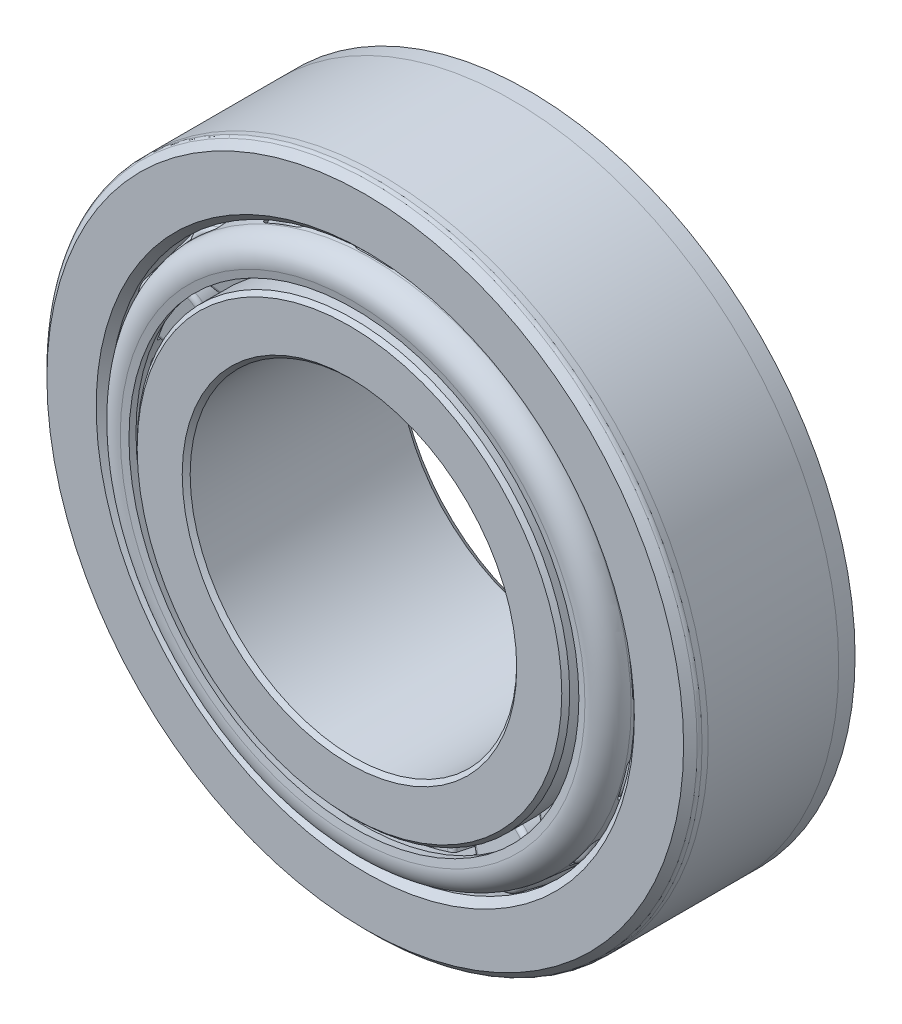
from build123d import *
from OCP.BRepFilletAPI import BRepFilletAPI_MakeChamfer

# Parameters (mm, degrees)
SKETCH8_R                 = 2.0375
CUT_EXTRUDE1_DEPTH        = 0.635
FILLET7_R                 = 0.9525
CHAMFER4_SIZE             = 0.509375
CHAMFER4_SIZE2            = 0.497844484
FILLET8_R                 = 0.54975
CIRPATTERN1_COUNT         = 17
FILLET9_R                 = 2.6025
FILLET10_R                = 0.32825
FILLET11_R                = 0.3665
CIRPATTERN2_COUNT         = 17
FILLET11_OF_CIRPATTERN2_R = 0.3665
CHAMFER1_SIZE             = 0.9575
CHAMFER1_SIZE2            = 0.812762916
FILLET6_R                 = 0.5745
CHAMFER2_SIZE             = 0.463875
CHAMFER3_SIZE             = 0.9055


with BuildPart() as part:
    # Sketch2 → Revolve1 (revolve)
    with BuildSketch(Plane(origin=(0, 0, 0), x_dir=(0, 0, -1), z_dir=(1, 0, 0)), mode=Mode.PRIVATE) as revolve1_sk:
        Polygon((-9.525, 38.1), (-9.525, 30.44), (9.525, 34.285), (9.525, 38.1), align=None)
    revolve(revolve1_sk.sketch.rotate(Axis((0, 0, 0), (0, 0, -1)), 90), axis=Axis((0, 0, 0), (0, 0, -1)))

    # Chamfer1: one chamfer whose edges measure the first distance from different faces: ONE call of the kernel's chamfer builder (chamfer() names one face for all edges)
    chamfer1_edges_1 = [part.edges().sort_by_distance(p)[0] for p in [
        (-30.44, 0, 9.525),
    ]]
    chamfer1_side_1 = [part.faces().sort_by_distance(p)[0] for p in [
        (-37.022369265, 0, 9.525),
    ]]
    chamfer1_edges_2 = [part.edges().sort_by_distance(p)[0] for p in [
        (-38.1, 0, 9.525),
    ]]
    chamfer1 = BRepFilletAPI_MakeChamfer(part.part.solid().wrapped)
    for e in chamfer1_edges_1:
        chamfer1.Add(CHAMFER1_SIZE, CHAMFER1_SIZE2, e.wrapped, chamfer1_side_1[0].wrapped)  # the first distance lies on this face
    for e in chamfer1_edges_2:
        chamfer1.Add(CHAMFER1_SIZE, e.wrapped)
    add(Compound.cast(chamfer1.Shape()), mode=Mode.REPLACE)

    # Fillet6
    fillet6_edges = [part.edges().sort_by_distance(p)[0] for p in [
        (-38.1, 0, 8.5675),
    ]]
    fillet(fillet6_edges, radius=FILLET6_R)


with BuildPart() as body_2:
    # Sketch3 → Revolve2 (revolve)
    with BuildSketch(Plane(origin=(0, 0, 0), x_dir=(0, 0, -1), z_dir=(1, 0, 0)), mode=Mode.PRIVATE) as revolve2_sk:
        Polygon((-11.3665, 25.235), (-11.3665, 19.05), (14.2875, 19.05), (14.2875, 28.105), (9.637718444, 28.105), (9.999281251, 26.068659801), (-7.293053691, 23.41472833), (-7.616252405, 25.235), align=None)
    revolve(revolve2_sk.sketch.rotate(Axis((0, 0, 0), (0, 0, -1)), 90), axis=Axis((0, 0, 0), (0, 0, -1)))

    # Chamfer2
    chamfer2_edges = [body_2.edges().sort_by_distance(p)[0] for p in [
        (-19.05, 0, 11.3665),
        (-25.235, 0, 11.3665),
    ]]
    chamfer(chamfer2_edges, length=CHAMFER2_SIZE)

    # Chamfer3
    chamfer3_edges = [body_2.edges().sort_by_distance(p)[0] for p in [
        (-28.105, 0, -14.2875),
        (-19.05, 0, -14.2875),
    ]]
    chamfer(chamfer3_edges, length=CHAMFER3_SIZE)


with BuildPart() as body_3:
    # Sketch4 → Revolve3 (revolve)
    with BuildSketch(Plane(origin=(0, 0, 0), x_dir=(0, 0, -1), z_dir=(1, 0, 0)), mode=Mode.PRIVATE) as revolve3_sk:
        Polygon((13.2715, 31.042304933), (13.094930889, 32.036751186), (-11.497784022, 29.908535063), (-10.847646334, 26.246926388), (-9.853200081, 26.423495499), (-9.941484637, 26.920718625), align=None)
    revolve(revolve3_sk.sketch.rotate(Axis((0, 0, 0), (0, 0, -1)), 90), axis=Axis((0, 0, 0), (0, 0, -1)))

    # Fillet9
    fillet9_edges = [body_3.edges().sort_by_distance(p)[0] for p in [
        (-29.908535063, 0, 11.497784022),
    ]]
    fillet(fillet9_edges, radius=FILLET9_R)

    # Fillet10
    fillet10_edges = [body_3.edges().sort_by_distance(p)[0] for p in [
        (-32.036751186, 0, -13.094930889),
        (-31.042304933, 0, -13.2715),
    ]]
    fillet(fillet10_edges, radius=FILLET10_R)

    # Sketch9 → Cut-Revolve2 (revolve, cut)
    with BuildSketch(Plane(origin=(0, 0, 0), x_dir=(0, 0, -1), z_dir=(1, 0, 0))):
        Polygon((-7.933772296, 27.023288246), (9.286886076, 30.080905819), (10.047348348, 25.797943455), (-7.244986594, 23.144011984), align=None)
    cut_revolve2 = revolve(axis=Axis((0, 27.023288246, 7.933772296), (0, 0.1748209018666769, -0.9846002499849986)), mode=Mode.SUBTRACT)

    # Fillet11
    fillet11_edges = [body_3.edges().sort_by_distance(p)[0] for p in [
        (-3.551195057, 28.703532077, 8.232108338),
        (3.551195057, 28.703532077, 8.232108338),
        (4.299952946, 30.728406183, -9.171919015),
        (-4.299952946, 30.728406183, -9.171919015),
    ]]
    fillet(fillet11_edges, radius=FILLET11_R)

    # CirPattern2: Cut-Revolve2 ×17 about axis
    cirpattern2_axis = Axis((0, 0, 0), (0, 0, 1))
    for i in range(1, CIRPATTERN2_COUNT):
        add(cut_revolve2.rotate(cirpattern2_axis, i * 360 / CIRPATTERN2_COUNT), mode=Mode.SUBTRACT)

    # Fillet11 of CirPattern2
    fillet11_of_cirpattern2_edges = [body_3.edges().sort_by_distance(p)[0] for p in [
        (-13.680302525, 25.482406928, 8.232108338),
        (-7.057520981, 28.048086167, 8.232108338),
        (-7.090793939, 30.206707586, -9.171919015),
        (-15.109967359, 27.100063253, -9.171919015),
        (-21.961809332, 18.819741521, 8.232108338),
        (-16.713079703, 23.6045908, 8.232108338),
        (-17.523889811, 25.605425749, -9.171919015),
        (-23.879296952, 19.811706613, -9.171919015),
        (-27.277252093, 9.615365737, 8.232108338),
        (-24.111444401, 15.973164649, 8.232108338),
        (-25.590287261, 17.545989279, -9.171919015),
        (-29.423595173, 9.847669216, -9.171919015),
        (-28.908750811, -0.88761847, 8.232108338),
        (-28.253424927, 6.184474101, 8.232108338),
        (-30.200574615, 7.116869732, -9.171919015),
        (-30.994073823, -1.446350477, -9.171919015),
        (-26.635962543, -11.270724884, 8.232108338),
        (-28.579623859, -4.439463944, 8.232108338),
        (-30.732107021, -4.273422508, -9.171919015),
        (-28.37863106, -12.545032524, -9.171919015),
        (-20.765839939, -20.131657449, 8.232108338),
        (-25.045986223, -14.463827783, 8.232108338),
        (-27.113098081, -15.086565359, -9.171919015),
        (-21.930496921, -21.949438414, -9.171919015),
        (-12.091175583, -26.273698122, 8.232108338),
        (-18.129749363, -22.534771533, 8.232108338),
        (-19.832315006, -23.862183961, -9.171919015),
        (-12.520527651, -28.38945102, -9.171919015),
        (-1.783530966, -28.867330277, 8.232108338),
        (-8.764989392, -27.562269518, 8.232108338),
        (-9.873067895, -29.415082393, -9.171919015),
        (-1.419591744, -30.995310954, -9.171919015),
        (8.764989392, -27.562269518, 8.232108338),
        (1.783530966, -28.867330277, 8.232108338),
        (1.419591744, -30.995310954, -9.171919015),
        (9.873067895, -29.415082393, -9.171919015),
        (18.129749363, -22.534771533, 8.232108338),
        (12.091175583, -26.273698122, 8.232108338),
        (12.520527651, -28.38945102, -9.171919015),
        (19.832315006, -23.862183961, -9.171919015),
        (25.045986223, -14.463827783, 8.232108338),
        (20.765839939, -20.131657449, 8.232108338),
        (21.930496921, -21.949438414, -9.171919015),
        (27.113098081, -15.086565359, -9.171919015),
        (28.579623859, -4.439463944, 8.232108338),
        (26.635962543, -11.270724884, 8.232108338),
        (28.37863106, -12.545032524, -9.171919015),
        (30.732107021, -4.273422508, -9.171919015),
        (28.253424927, 6.184474101, 8.232108338),
        (28.908750811, -0.88761847, 8.232108338),
        (30.994073823, -1.446350477, -9.171919015),
        (30.200574615, 7.116869732, -9.171919015),
        (24.111444401, 15.973164649, 8.232108338),
        (27.277252093, 9.615365737, 8.232108338),
        (29.423595173, 9.847669216, -9.171919015),
        (25.590287261, 17.545989279, -9.171919015),
        (16.713079703, 23.6045908, 8.232108338),
        (21.961809332, 18.819741521, 8.232108338),
        (23.879296952, 19.811706613, -9.171919015),
        (17.523889811, 25.605425749, -9.171919015),
        (7.057520981, 28.048086167, 8.232108338),
        (13.680302525, 25.482406928, 8.232108338),
        (15.109967359, 27.100063253, -9.171919015),
        (7.090793939, 30.206707586, -9.171919015),
    ]]
    fillet(fillet11_of_cirpattern2_edges, radius=FILLET11_OF_CIRPATTERN2_R)


with BuildPart() as body_4:
    # Sketch6 → Revolve4 (revolve)
    with BuildSketch(Plane(origin=(0, 0, 0), x_dir=(0, 0, -1), z_dir=(1, 0, 0))):
        Polygon((9.999281251, 26.068659801), (9.286886076, 30.080905819), (-7.933772296, 27.023288246), (-7.293053691, 23.41472833), align=None)
    revolve(axis=Axis((0, 27.023288246, 7.933772296), (0, 0.17482090186667695, -0.9846002499849986)))

    # Sketch8 → Cut-Extrude1 (cut)
    with BuildSketch(Plane(origin=(0, 2.517882765, -14.180844359), x_dir=(-1, 0, 0), z_dir=(0, 0.17482090186667693, -0.9846002499849986))):
        with Locations(Location((0, 27.99412559, 0), (0, 0, 90))):
            Circle(SKETCH8_R)
    extrude(amount=-CUT_EXTRUDE1_DEPTH, mode=Mode.SUBTRACT)

    # Fillet7
    # the kernel refuses this fillet: 0.9525 mm, written as the material it adds along each edge
    with BuildSketch(Plane(origin=(0, 29.969894547, -8.661664918), x_dir=(0, 0.9846002499849985, 0.1748209018666771), z_dir=(-1, 0, 0))) as fillet7_piece_1:
        with BuildLine():
            CenterArc((1.139474388, 0.9525), FILLET7_R, 270, 70.528779366)
            Line((1.139474388, 0), (1.139474388, -0.01905))
            Line((1.139474388, -0.01905), (2.0375, -0.01905))
            Line((2.0375, -0.01905), (2.05655, 0))
            ThreePointArc((2.05655, 0), (2.05655, 0.3175), (2.055460512, 0.62865))
            Line((2.055460512, 0.62865), (2.0375, 0.635))
        make_face()
    revolve(axis=Axis((0, 29.969894547, -8.661664918), (0, 0.17482090186667693, -0.9846002499849986)))

    # Chamfer4
    chamfer4_edges = [body_4.edges().sort_by_distance(p)[0] for p in [
        (0, 34.093151838, -8.574490901),
    ]]
    chamfer4_side = [body_4.faces().sort_by_distance(p)[0] for p in [
        (0, 33.979668383, -8.59464048),
    ]]
    chamfer(chamfer4_edges, length=CHAMFER4_SIZE, length2=CHAMFER4_SIZE2, reference=chamfer4_side[0])

    # Fillet8
    fillet8_edges = [body_4.edges().sort_by_distance(p)[0] for p in [
        (0, 30.631848162, 8.574490901),
    ]]
    fillet(fillet8_edges, radius=FILLET8_R)


with BuildPart() as cirpattern1_1:
    # CirPattern1: pattern copy
    add(body_4.part.rotate(Axis((0, 0, 0), (0, 0, 1)), 1 * 360 / CIRPATTERN1_COUNT))


with BuildPart() as cirpattern1_2:
    # CirPattern1: pattern copy
    add(body_4.part.rotate(Axis((0, 0, 0), (0, 0, 1)), 2 * 360 / CIRPATTERN1_COUNT))


with BuildPart() as cirpattern1_3:
    # CirPattern1: pattern copy
    add(body_4.part.rotate(Axis((0, 0, 0), (0, 0, 1)), 3 * 360 / CIRPATTERN1_COUNT))


with BuildPart() as cirpattern1_4:
    # CirPattern1: pattern copy
    add(body_4.part.rotate(Axis((0, 0, 0), (0, 0, 1)), 4 * 360 / CIRPATTERN1_COUNT))


with BuildPart() as cirpattern1_5:
    # CirPattern1: pattern copy
    add(body_4.part.rotate(Axis((0, 0, 0), (0, 0, 1)), 5 * 360 / CIRPATTERN1_COUNT))


with BuildPart() as cirpattern1_6:
    # CirPattern1: pattern copy
    add(body_4.part.rotate(Axis((0, 0, 0), (0, 0, 1)), 6 * 360 / CIRPATTERN1_COUNT))


with BuildPart() as cirpattern1_7:
    # CirPattern1: pattern copy
    add(body_4.part.rotate(Axis((0, 0, 0), (0, 0, 1)), 7 * 360 / CIRPATTERN1_COUNT))


with BuildPart() as cirpattern1_8:
    # CirPattern1: pattern copy
    add(body_4.part.rotate(Axis((0, 0, 0), (0, 0, 1)), 8 * 360 / CIRPATTERN1_COUNT))


with BuildPart() as cirpattern1_9:
    # CirPattern1: pattern copy
    add(body_4.part.rotate(Axis((0, 0, 0), (0, 0, 1)), 9 * 360 / CIRPATTERN1_COUNT))


with BuildPart() as cirpattern1_10:
    # CirPattern1: pattern copy
    add(body_4.part.rotate(Axis((0, 0, 0), (0, 0, 1)), 10 * 360 / CIRPATTERN1_COUNT))


with BuildPart() as cirpattern1_11:
    # CirPattern1: pattern copy
    add(body_4.part.rotate(Axis((0, 0, 0), (0, 0, 1)), 11 * 360 / CIRPATTERN1_COUNT))


with BuildPart() as cirpattern1_12:
    # CirPattern1: pattern copy
    add(body_4.part.rotate(Axis((0, 0, 0), (0, 0, 1)), 12 * 360 / CIRPATTERN1_COUNT))


with BuildPart() as cirpattern1_13:
    # CirPattern1: pattern copy
    add(body_4.part.rotate(Axis((0, 0, 0), (0, 0, 1)), 13 * 360 / CIRPATTERN1_COUNT))


with BuildPart() as cirpattern1_14:
    # CirPattern1: pattern copy
    add(body_4.part.rotate(Axis((0, 0, 0), (0, 0, 1)), 14 * 360 / CIRPATTERN1_COUNT))


with BuildPart() as cirpattern1_15:
    # CirPattern1: pattern copy
    add(body_4.part.rotate(Axis((0, 0, 0), (0, 0, 1)), 15 * 360 / CIRPATTERN1_COUNT))


with BuildPart() as cirpattern1_16:
    # CirPattern1: pattern copy
    add(body_4.part.rotate(Axis((0, 0, 0), (0, 0, 1)), 16 * 360 / CIRPATTERN1_COUNT))


solid = Compound([part.part, body_2.part, body_3.part, body_4.part, cirpattern1_1.part, cirpattern1_2.part, cirpattern1_3.part, cirpattern1_4.part, cirpattern1_5.part, cirpattern1_6.part, cirpattern1_7.part, cirpattern1_8.part, cirpattern1_9.part, cirpattern1_10.part, cirpattern1_11.part, cirpattern1_12.part, cirpattern1_13.part, cirpattern1_14.part, cirpattern1_15.part, cirpattern1_16.part])
